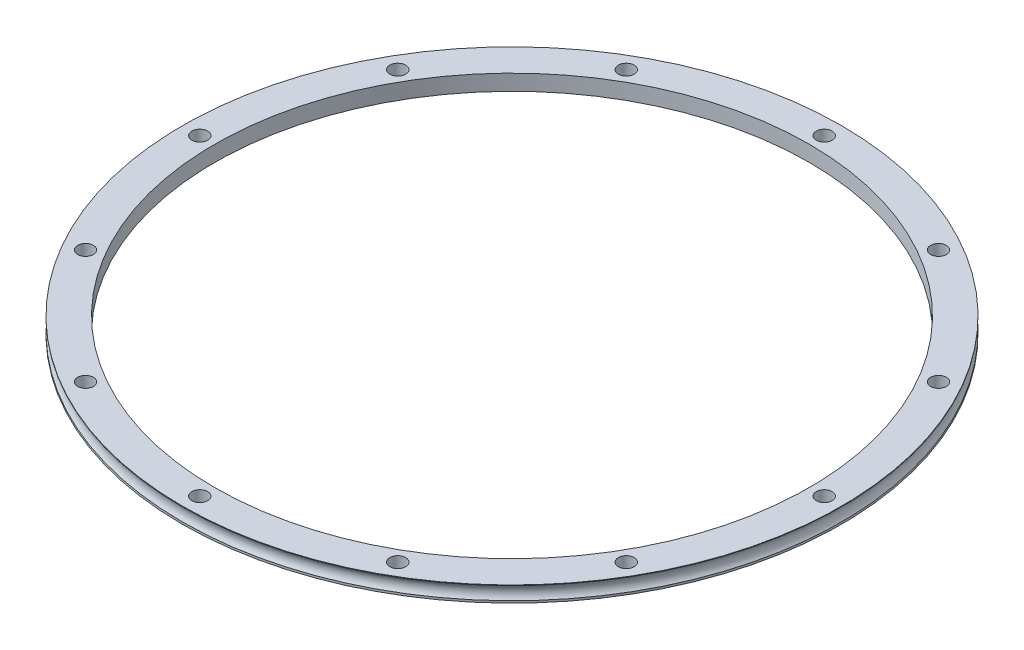
from build123d import *

# Parameters (mm, degrees)
SKETCH3_R          = 1.6
CUT_EXTRUDE1_DEPTH = 95.098950047
CIRPATTERN1_COUNT  = 12


with BuildPart() as part:
    # Sketch1 → Revolve1 (revolve)
    with BuildSketch(Plane.XY):
        with BuildLine():
            Line((-66.5, 9.857875656), (-66.5, 9.965))
            Line((-66.5, 9.965), (-60, 9.965))
            Line((-60, 9.965), (-60, 6.785))
            Line((-60, 6.785), (-66.5, 6.785))
            Line((-66.5, 6.785), (-66.5, 7.212124344))
            ThreePointArc((-66.5, 7.212124344), (-66, 8.535), (-66.5, 9.857875656))
        make_face()
    revolve(axis=Axis((0, -200069.047495165, 0), (0, 1, 0)))

    # Sketch3 → Cut-Extrude1 (cut, through all)
    with BuildSketch(Plane(origin=(0, 9.965, 0), x_dir=(1, 0, 0), z_dir=(0, 1, 0))):
        with Locations((0, 63)):
            Circle(SKETCH3_R)
    cut_extrude1 = extrude(amount=-CUT_EXTRUDE1_DEPTH, mode=Mode.SUBTRACT)

    # CirPattern1: Cut-Extrude1 ×12 about axis
    cirpattern1_axis = Axis((0, -200069.047495165, 0), (0, -1, 0))
    for i in range(1, CIRPATTERN1_COUNT):
        add(cut_extrude1.rotate(cirpattern1_axis, i * 360 / CIRPATTERN1_COUNT), mode=Mode.SUBTRACT)


solid = part.part
